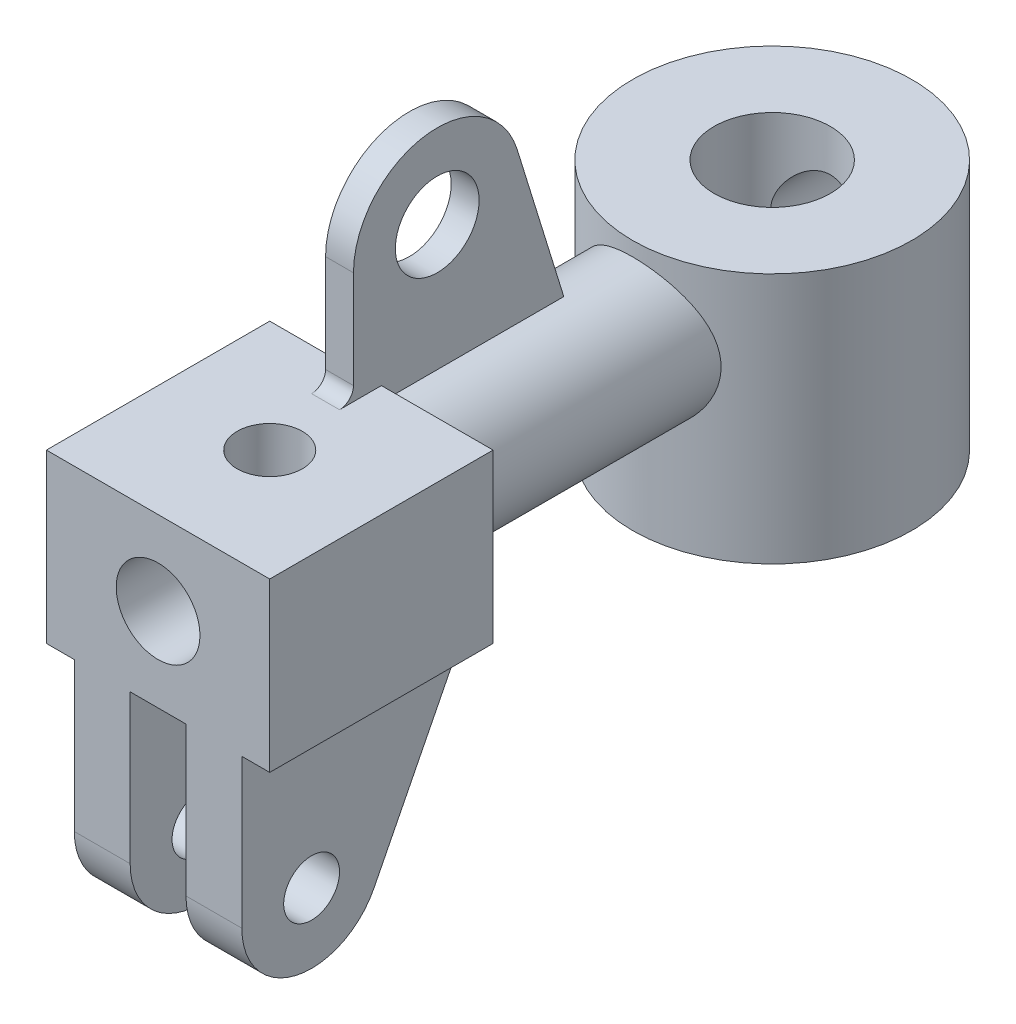
from build123d import *

# Parameters (mm, degrees)
BOSS_EXTRUDE1_DEPTH       = 24
BOSS_EXTRUDE1_DEPTH_BACK  = 24
SKETCH1_W                 = 48
SKETCH1_H                 = 36
BOSS_EXTRUDE2_DEPTH       = 12
BOSS_EXTRUDE3_START       = -12
BOSS_EXTRUDE3_DEPTH       = 12
SKETCH7_R                 = 6
CUT_EXTRUDE1_DEPTH        = 105.675689632
SKETCH9_R                 = 30
SKETCH9_R_2               = 12.5
BOSS_EXTRUDE4_DEPTH       = 54
BOSS_EXTRUDE5_REACH       = 146.17
BOSS_EXTRUDE5_END_RADIUS  = 30
SKETCH10_R                = 15
SKETCH11_R                = 9
CUT_EXTRUDE2_DEPTH        = 185.480351361
BOSS_EXTRUDE6_START       = -87.205977382
BOSS_EXTRUDE6_DEPTH       = 39.205977382
BOSS_EXTRUDE6_START_2     = -77.335756752
BOSS_EXTRUDE6_2_DEPTH     = 29.335756752
BOSS_EXTRUDE6_START_3     = -6
BOSS_EXTRUDE6_3_OUTLINE_R = 9
BOSS_EXTRUDE6_3_DEPTH     = 6
CUT_EXTRUDE3_REACH        = 186.48
CUT_EXTRUDE3_END_RADIUS   = 9
SKETCH13_R                = 7


with BuildPart() as part:
    # Sketch1 → Boss-Extrude1 (new, two sides: drawn at the far end of the back side and taken through both)
    with BuildSketch(Plane(origin=(0, 0, 0), x_dir=(0, 0, -1), z_dir=(1, 0, 0)).offset(-BOSS_EXTRUDE1_DEPTH_BACK)):
        with Locations((24, -18)):
            Rectangle(SKETCH1_W, SKETCH1_H)
    extrude(amount=BOSS_EXTRUDE1_DEPTH + BOSS_EXTRUDE1_DEPTH_BACK)

    # Sketch2 → Boss-Extrude2 (add)
    with BuildSketch(Plane(origin=(18, 0, 0), x_dir=(0, 0, -1), z_dir=(1, 0, 0))):
        with BuildLine():
            Line((0, -36), (0, -68))
            ThreePointArc((0, -68), (11.519205494, -82.590547269), (28.384542614, -74.771559571))
            Line((28.384542614, -74.771559571), (48, -36))
            Line((48, -36), (0, -36))
        make_face()
    extrude(amount=-BOSS_EXTRUDE2_DEPTH)

    # Sketch6 → Boss-Extrude3 (add)
    with BuildSketch(Plane.ZY.offset(18).offset(BOSS_EXTRUDE3_START)):
        with BuildLine():
            Line((0, -36), (0, -68))
            ThreePointArc((0, -68), (-11.519205494, -82.590547269), (-28.384542614, -74.771559571))
            Line((-28.384542614, -74.771559571), (-48, -36))
            Line((-48, -36), (-48, 0))
            Line((-48, 0), (0, 0))
            Line((0, 0), (0, -36))
        make_face()
    extrude(amount=BOSS_EXTRUDE3_DEPTH)

    # Sketch7 → Cut-Extrude1 (cut, through all)
    with BuildSketch(Plane(origin=(18, 0, 0), x_dir=(0, 0, -1), z_dir=(1, 0, 0))):
        with Locations((15, -68)):
            Circle(SKETCH7_R)
    extrude(amount=-CUT_EXTRUDE1_DEPTH, mode=Mode.SUBTRACT)



with BuildPart() as body_2:
    # Sketch9 → Boss-Extrude4 (new body)
    with BuildSketch(Plane(origin=(0, 0, 0), x_dir=(1, 0, 0), z_dir=(0, 1, 0))):
        with Locations(Location((0, 132, 0), (0, 0, 270))):
            Circle(SKETCH9_R)
        with Locations(Location((0, 132, 0), (0, 0, 270))):
            Circle(SKETCH9_R_2, mode=Mode.SUBTRACT)
    extrude(amount=-BOSS_EXTRUDE4_DEPTH)


with BuildPart() as part_1:
    add(part.part)

    add(body_2.part)  # Boss-Extrude5 merges body 2
    # Boss-Extrude5: up to this cylinder (the profile starts outside it)
    boss_extrude5_end = Plane(origin=(0, -18.040976, -132), z_dir=(0, 1, 0)) * Cylinder(BOSS_EXTRUDE5_END_RADIUS, 353.34, mode=Mode.PRIVATE)
    # Sketch10 → Boss-Extrude5 (add, up to the surface)
    with BuildSketch(Plane(origin=(0, 0, -48), x_dir=(-1, 0, 0), z_dir=(0, 0, -1)), mode=Mode.PRIVATE) as boss_extrude5_sk1:
        with Locations(Location((0, -18.040976412, 0), (0, 0, 270))):
            Circle(SKETCH10_R)
    boss_extrude5_tool1 = extrude(boss_extrude5_sk1.sketch, amount=BOSS_EXTRUDE5_REACH, mode=Mode.PRIVATE) - boss_extrude5_end
    add(boss_extrude5_tool1.solids().sort_by_distance((0, -18.040976, -48))[0])

    # Sketch11 → Cut-Extrude2 (cut, through all)
    with BuildSketch(Plane.XY):
        with Locations((0, -18)):
            Circle(SKETCH11_R)
    extrude(amount=-CUT_EXTRUDE2_DEPTH, mode=Mode.SUBTRACT)

    # Boss-Extrude6: read off the stored shape, not the designer's step
    # Boss-Extrude6 outline → Boss-Extrude6 (add)
    with BuildSketch(Plane.XY.offset(BOSS_EXTRUDE6_START)):
        with BuildLine():
            ThreePointArc((8.763833852, -20.048222698), (4.591126901, -10.259098646), (-6, -11.291796068))
            Line((-6, -11.291796068), (-6, -20.048222698))
            Line((-6, -20.048222698), (8.763833852, -20.048222698))
        make_face()
    extrude(amount=BOSS_EXTRUDE6_DEPTH)

    # Boss-Extrude6 2 outline → Boss-Extrude6 2 (add)
    with BuildSketch(Plane.XY.offset(BOSS_EXTRUDE6_START_2)):
        with BuildLine():
            Line((0, 0), (-6, 0))
            Line((-6, 0), (-6, -4.293249327))
            ThreePointArc((-6, -4.293249327), (-3.064644655, -3.357381718), (0, -3.040976412))
            Line((0, -3.040976412), (0, 0))
        make_face()
    extrude(amount=BOSS_EXTRUDE6_2_DEPTH)

    # Boss-Extrude6 3 outline → Boss-Extrude6 3 (add)
    with BuildSketch(Plane.YZ.offset(BOSS_EXTRUDE6_START_3)):
        with BuildLine():
            Line((-6, -87.205977382), (-3.040976412, -87.205977382))
            Line((-3.040976412, -87.205977382), (29.319215471, -77.196102662))
            ThreePointArc((29.319215471, -77.196102662), (41.797890998, -57.310190334), (24, -42))
            Line((24, -42), (3, -42))
            ThreePointArc((3, -42), (0.878679656, -41.121320344), (0, -39))
            Line((0, -39), (0, -77.335756752))
            Line((0, -77.335756752), (-6, -77.335756752))
            Line((-6, -77.335756752), (-6, -87.205977382))
        make_face()
        with Locations((24, -60)):
            Circle(BOSS_EXTRUDE6_3_OUTLINE_R, mode=Mode.SUBTRACT)
    extrude(amount=BOSS_EXTRUDE6_3_DEPTH)

    # Cut-Extrude3: up to this cylinder (the profile starts outside it)
    cut_extrude3_end = Plane(origin=(0, -18, -24), z_dir=(0, 0, 1)) * Cylinder(CUT_EXTRUDE3_END_RADIUS, 391.96, mode=Mode.PRIVATE)
    # Sketch13 → Cut-Extrude3 (cut, up to the surface)
    with BuildSketch(Plane(origin=(0, 0, 0), x_dir=(1, 0, 0), z_dir=(0, 1, 0)), mode=Mode.PRIVATE) as cut_extrude3_sk1:
        with Locations(Location((0, 24, 0), (0, 0, 270))):
            Circle(SKETCH13_R)
    cut_extrude3_tool1 = extrude(cut_extrude3_sk1.sketch, amount=-CUT_EXTRUDE3_REACH, mode=Mode.PRIVATE) - cut_extrude3_end
    add(cut_extrude3_tool1.solids().sort_by_distance((0, 0, -24))[0], mode=Mode.SUBTRACT)


solid = part_1.part
